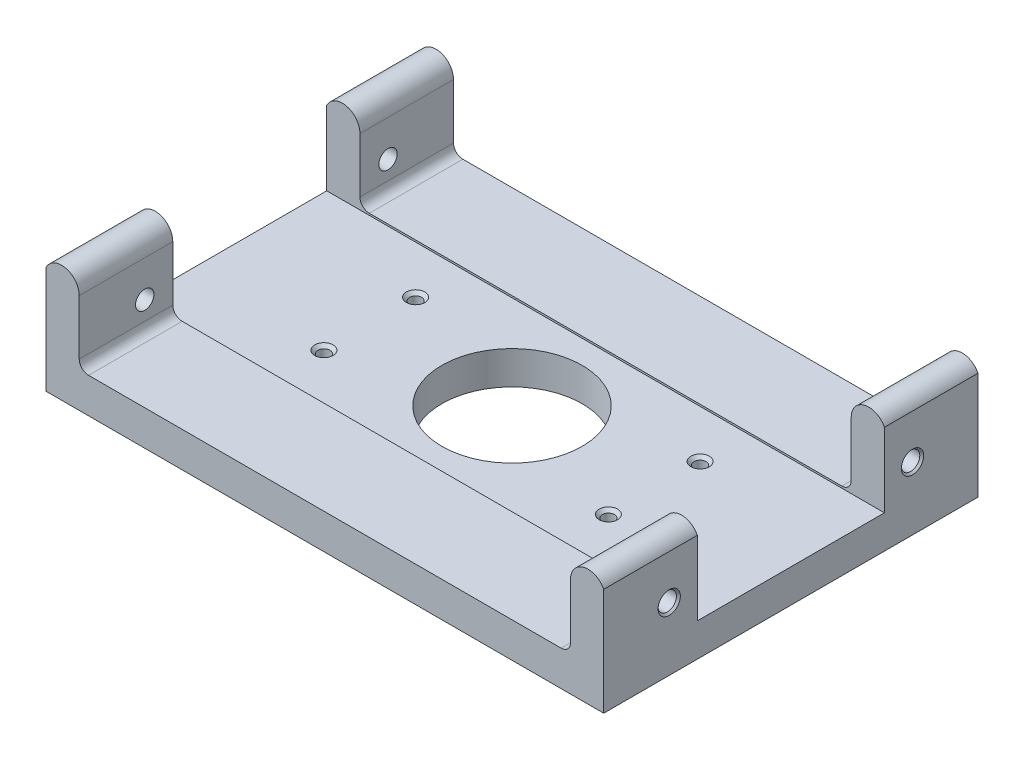
from build123d import *

# Parameters (mm, degrees)
EXTRUDE_THIN1_DEPTH             = 50.8
FILLET1_RADIUS                  = 4.7625
FILLET1_LENGTH                  = 50.8
FILLET2_R                       = 2.54
CUT_EXTRUDE1_DEPTH              = 97.928543268
CUT_EXTRUDE1_DEPTH_BACK         = 97.928543268
SKETCH5_W                       = 25.4
SKETCH5_H                       = 22.733
CUT_EXTRUDE3_START              = -76.2
SKETCH8_W                       = 50.8
SKETCH8_H                       = 31.75
CUT_EXTRUDE3_DEPTH              = 0.508
M6X1_0_TAPPED_HOLE1_D           = 5
M6X1_0_TAPPED_HOLE1_CSINK_D     = 6.05
M6X1_0_TAPPED_HOLE1_CSINK_ANGLE = 90
MIRROR1_START                   = -50.8
MIRROR1_OUTLINE_W               = 151.384
MIRROR1_OUTLINE_H               = 9.017
MIRROR1_DEPTH                   = 101.6
MIRROR1_2_DEPTH                 = 15.2799999
MIRROR1_START_2                 = 35.5200001
MIRROR1_3_DEPTH                 = 15.2799999
MIRROR1_START_3                 = -30.5199999
MIRROR1_4_DEPTH                 = 5.1199999
MIRROR1_START_4                 = 25.4
MIRROR1_5_DEPTH                 = 5.1199999
MIRROR1_START_5                 = -35.5200001
MIRROR1_6_DEPTH                 = 5.0000002
MIRROR1_START_6                 = 30.5199999
MIRROR1_7_DEPTH                 = 5.0000002
CUT_EXTRUDE2_DEPTH              = 97.529691619
CUT_EXTRUDE2_DEPTH_BACK         = 97.529691619
SKETCH7_R                       = 19.05
M4X0_7_TAPPED_HOLE3_D           = 3.3
M4X0_7_TAPPED_HOLE3_CSINK_D     = 5
M4X0_7_TAPPED_HOLE3_CSINK_ANGLE = 90


with BuildPart() as part:
    # Sketch4 → Extrude-Thin1 (new body)
    with BuildSketch(Plane.XY):
        Polygon((0, 0), (-76.2, 0), (-76.2, 31.75), (-66.675, 31.75), (-66.675, 9.525), (0, 9.525), align=None)
    extrude(amount=EXTRUDE_THIN1_DEPTH)

    # Fillet1: full round fillet: the end face becomes a half cylinder, R = half its width
    fillet1_face = Plane((-71.4375, 31.75, 25.4), x_dir=(0, 0, -1), z_dir=(0, 1, 0))  # on the end face: x along it, z out of the body
    fillet1_slab = fillet1_face.offset(-FILLET1_RADIUS / 2) * Box(FILLET1_LENGTH, 2 * FILLET1_RADIUS, FILLET1_RADIUS, mode=Mode.PRIVATE)  # the body's end, R deep
    fillet1_round = Plane((-71.4375, 26.9875, 25.4), x_dir=(0, 1, 0), z_dir=(0, 0, -1)) * Cylinder(FILLET1_RADIUS, FILLET1_LENGTH, mode=Mode.PRIVATE)  # its axis R under the face
    add(fillet1_slab - fillet1_round, mode=Mode.SUBTRACT)

    # Fillet2
    fillet2_edges = [part.edges().sort_by_distance(p)[0] for p in [
        (-66.675, 9.525, 25.4),
    ]]
    fillet(fillet2_edges, radius=FILLET2_R)

    # Sketch5 → Cut-Extrude1 (cut, two sides: drawn at the far end of the back side and taken through both)
    with BuildSketch(Plane(origin=(0, 0, 0), x_dir=(0, 0, -1), z_dir=(1, 0, 0)).offset(-CUT_EXTRUDE1_DEPTH_BACK)):
        with Locations((-12.7, 20.3835)):
            Rectangle(SKETCH5_W, SKETCH5_H)
    extrude(amount=CUT_EXTRUDE1_DEPTH + CUT_EXTRUDE1_DEPTH_BACK, mode=Mode.SUBTRACT)

    # Sketch8 → Cut-Extrude3 (cut)
    with BuildSketch(Plane(origin=(0, 0, 0), x_dir=(0, 0, -1), z_dir=(1, 0, 0)).offset(CUT_EXTRUDE3_START)):
        with Locations((-25.4, 15.875)):
            Rectangle(SKETCH8_W, SKETCH8_H)
    extrude(amount=CUT_EXTRUDE3_DEPTH, mode=Mode.SUBTRACT)

    # M6x1.0 Tapped Hole1 (through all)
    with Locations(Plane.ZY.offset(75.692)):
        with Locations((33.02, 17.145)):
            CounterSinkHole(M6X1_0_TAPPED_HOLE1_D / 2, M6X1_0_TAPPED_HOLE1_CSINK_D / 2, counter_sink_angle=M6X1_0_TAPPED_HOLE1_CSINK_ANGLE)

    # Mirror1: read off the stored shape, not the designer's step
    # Mirror1 outline → Mirror1 (add)
    with BuildSketch(Plane.XY.offset(MIRROR1_START)):
        with Locations((0, 4.5085)):
            Rectangle(MIRROR1_OUTLINE_W, MIRROR1_OUTLINE_H)
    extrude(amount=MIRROR1_DEPTH)

    # Mirror1 2 outline → Mirror1 2 (add)
    with BuildSketch(Plane.XY.offset(MIRROR1_START)):
        with BuildLine():
            Line((-66.675, 12.065), (-66.675, 26.9875))
            ThreePointArc((-66.675, 26.9875), (-70.337647737, 31.621259947), (-75.692, 29.127742042))
            Line((-75.692, 29.127742042), (-75.692, 9.017))
            Line((-75.692, 9.017), (75.692, 9.017))
            Line((75.692, 9.017), (75.692, 29.127742042))
            ThreePointArc((75.692, 29.127742042), (70.337647737, 31.621259947), (66.675, 26.9875))
            Line((66.675, 26.9875), (66.675, 12.065))
            ThreePointArc((66.675, 12.065), (65.931051224, 10.268948776), (64.135, 9.525))
            Line((64.135, 9.525), (-64.135, 9.525))
            ThreePointArc((-64.135, 9.525), (-65.931051224, 10.268948776), (-66.675, 12.065))
        make_face()
    extrude(amount=MIRROR1_2_DEPTH)

    # Mirror1 3 outline → Mirror1 3 (add)
    with BuildSketch(Plane.XY.offset(MIRROR1_START_2)):
        with BuildLine():
            Line((0, 9.525), (0, 9.017))
            Line((0, 9.017), (75.692, 9.017))
            Line((75.692, 9.017), (75.692, 29.127742042))
            ThreePointArc((75.692, 29.127742042), (70.337647737, 31.621259947), (66.675, 26.9875))
            Line((66.675, 26.9875), (66.675, 12.065))
            ThreePointArc((66.675, 12.065), (65.931051224, 10.268948776), (64.135, 9.525))
            Line((64.135, 9.525), (0, 9.525))
        make_face()
    extrude(amount=MIRROR1_3_DEPTH)

    # Mirror1 4 outline → Mirror1 4 (add)
    with BuildSketch(Plane.XY.offset(MIRROR1_START_3)):
        with BuildLine():
            Line((-66.675, 12.065), (-66.675, 26.9875))
            ThreePointArc((-66.675, 26.9875), (-70.337647737, 31.621259947), (-75.692, 29.127742042))
            Line((-75.692, 29.127742042), (-75.692, 9.017))
            Line((-75.692, 9.017), (75.692, 9.017))
            Line((75.692, 9.017), (75.692, 29.127742042))
            ThreePointArc((75.692, 29.127742042), (70.337647737, 31.621259947), (66.675, 26.9875))
            Line((66.675, 26.9875), (66.675, 12.065))
            ThreePointArc((66.675, 12.065), (65.931051224, 10.268948776), (64.135, 9.525))
            Line((64.135, 9.525), (-64.135, 9.525))
            ThreePointArc((-64.135, 9.525), (-65.931051224, 10.268948776), (-66.675, 12.065))
        make_face()
    extrude(amount=MIRROR1_4_DEPTH)

    # Mirror1 5 outline → Mirror1 5 (add)
    with BuildSketch(Plane.XY.offset(MIRROR1_START_4)):
        with BuildLine():
            Line((0, 9.525), (0, 9.017))
            Line((0, 9.017), (75.692, 9.017))
            Line((75.692, 9.017), (75.692, 29.127742042))
            ThreePointArc((75.692, 29.127742042), (70.337647737, 31.621259947), (66.675, 26.9875))
            Line((66.675, 26.9875), (66.675, 12.065))
            ThreePointArc((66.675, 12.065), (65.931051224, 10.268948776), (64.135, 9.525))
            Line((64.135, 9.525), (0, 9.525))
        make_face()
    extrude(amount=MIRROR1_5_DEPTH)

    # Mirror1 6 outline → Mirror1 6 (add)
    with BuildSketch(Plane.XY.offset(MIRROR1_START_5)):
        with BuildLine():
            Line((-66.675, 12.065), (-66.675, 26.9875))
            ThreePointArc((-66.675, 26.9875), (-70.337647737, 31.621259947), (-75.692, 29.127742042))
            Line((-75.692, 29.127742042), (-75.692, 9.017))
            Line((-75.692, 9.017), (75.692, 9.017))
            Line((75.692, 9.017), (75.692, 29.127742042))
            ThreePointArc((75.692, 29.127742042), (70.337647737, 31.621259947), (66.675, 26.9875))
            Line((66.675, 26.9875), (66.675, 12.065))
            ThreePointArc((66.675, 12.065), (65.931051224, 10.268948776), (64.135, 9.525))
            Line((64.135, 9.525), (-64.135, 9.525))
            ThreePointArc((-64.135, 9.525), (-65.931051224, 10.268948776), (-66.675, 12.065))
        make_face()
    extrude(amount=MIRROR1_6_DEPTH)

    # Mirror1 7 outline → Mirror1 7 (add)
    with BuildSketch(Plane.XY.offset(MIRROR1_START_6)):
        with BuildLine():
            Line((0, 9.525), (0, 9.017))
            Line((0, 9.017), (75.692, 9.017))
            Line((75.692, 9.017), (75.692, 29.127742042))
            ThreePointArc((75.692, 29.127742042), (70.337647737, 31.621259947), (66.675, 26.9875))
            Line((66.675, 26.9875), (66.675, 12.065))
            ThreePointArc((66.675, 12.065), (65.931051224, 10.268948776), (64.135, 9.525))
            Line((64.135, 9.525), (0, 9.525))
        make_face()
    extrude(amount=MIRROR1_7_DEPTH)

    # Mirror1 8 outline → Mirror1 8 (revolve, cut)
    with BuildSketch(Plane(origin=(0, 17.145, 33.02), x_dir=(0, 1, 0), z_dir=(0, 0, -1))):
        Polygon((0, 66.675), (2.5, 66.675), (2.5, 75.167), (3.025, 75.692), (0, 75.692), align=None)
    revolve(axis=Axis((0, 17.145, 33.02), (1, 0, 0)), mode=Mode.SUBTRACT)

    # Mirror1 9 outline → Mirror1 9 (revolve, cut)
    with BuildSketch(Plane(origin=(0, 17.145, -33.02), x_dir=(0, 1, 0), z_dir=(0, 0, -1))):
        Polygon((2.5, -75.167), (2.5, -66.675), (0, -66.675), (0, -75.692), (3.025, -75.692), align=None)
        Polygon((0, 66.675), (2.5, 66.675), (2.5, 75.167), (3.025, 75.692), (0, 75.692), align=None)
    revolve(axis=Axis((0, 17.145, -33.02), (1, 0, 0)), mode=Mode.SUBTRACT)

    # Sketch7 → Cut-Extrude2 (cut, two sides: drawn at the far end of the back side and taken through both)
    with BuildSketch(Plane(origin=(0, 0, 0), x_dir=(1, 0, 0), z_dir=(0, 1, 0)).offset(-CUT_EXTRUDE2_DEPTH_BACK)):
        with Locations(Location((0, 0, 0), (0, 0, 270))):
            Circle(SKETCH7_R)
    extrude(amount=CUT_EXTRUDE2_DEPTH + CUT_EXTRUDE2_DEPTH_BACK, mode=Mode.SUBTRACT)

    # M4x0.7 Tapped Hole3 (through all)
    with Locations(Plane(origin=(0, 9.017, 0), x_dir=(1, 0, 0), z_dir=(0, 1, 0))):
        with Locations((38.608, -12.446), (-38.608, -12.446), (-38.608, 12.446), (38.608, 12.446)):
            CounterSinkHole(M4X0_7_TAPPED_HOLE3_D / 2, M4X0_7_TAPPED_HOLE3_CSINK_D / 2, counter_sink_angle=M4X0_7_TAPPED_HOLE3_CSINK_ANGLE)


solid = part.part
